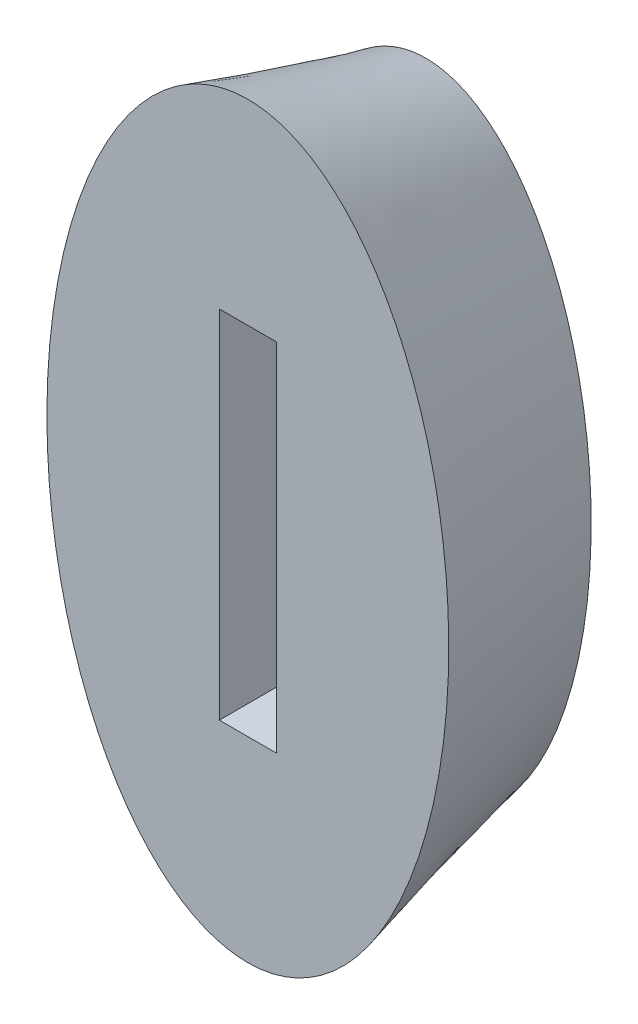
from build123d import *

# Parameters (mm, degrees)
SKETCH5_W          = 4
SKETCH5_H          = 25
CUT_EXTRUDE1_DEPTH = 30
SKETCH6_RX         = 19.310573212
SKETCH6_RY         = 9.889154818
SKETCH6_W          = 8.018233636
SKETCH6_H          = 30.068363878
CUT_EXTRUDE2_DEPTH = 7.5


with BuildPart() as part:
    # Loft1: read off the stored shape, not the designer's step
    # Loft1: loft between two sections, ruled curve by curve
    loft1_from = [
        Edge.make_bspline([(13.179644062, 9.355811816, 0), (23.234735985, -39.696457663, 0), (-3.12455214, -58.408081295, 0), (-13.179644062, -9.355811816, 0), (-23.234735985, 39.696457663, 0), (3.12455214, 58.408081295, 0), (13.179644062, 9.355811816, 0)], [0, 0, 0, 0, 0.5, 0.5, 0.5, 1, 1, 1, 1], 3, [1, 0.333333333, 0.333333333, 1, 0.333333333, 0.333333333, 1]),
    ]
    loft1_to = [
        Edge.make_bspline([(9.967428641, 11.526361015, -12.5), (21.858534946, -27.12039832, -12.5), (1.923677664, -50.173120349, -12.5), (-9.967428641, -11.526361015, -12.5), (-21.858534946, 27.12039832, -12.5), (-1.923677664, 50.173120349, -12.5), (9.967428641, 11.526361015, -12.5)], [0, 0, 0, 0, 0.5, 0.5, 0.5, 1, 1, 1, 1], 3, [1, 0.333333333, 0.333333333, 1, 0.333333333, 0.333333333, 1]),
    ]
    loft1 = Solid(Shell([*[Face.make_surface_from_curves(loft1_from[k], loft1_to[k]) for k in range(1)], Face(Wire(loft1_from)), Face(Wire(loft1_to))]))
    add(loft1)

    # Sketch5 → Cut-Extrude1 (cut)
    with BuildSketch(Plane.XY):
        Rectangle(SKETCH5_W, SKETCH5_H)
    extrude(amount=-CUT_EXTRUDE1_DEPTH, mode=Mode.SUBTRACT)

    # Sketch6 → Cut-Extrude2 (cut)
    with BuildSketch(Plane(origin=(0, 0, -12.5), x_dir=(-1, 0, 0), z_dir=(0, 0, -1))):
        with Locations(Location((0, 0), (0, 0, -90))):
            Ellipse(SKETCH6_RX, SKETCH6_RY)
        Rectangle(SKETCH6_W, SKETCH6_H, mode=Mode.SUBTRACT)
    extrude(amount=-CUT_EXTRUDE2_DEPTH, mode=Mode.SUBTRACT)


solid = part.part
